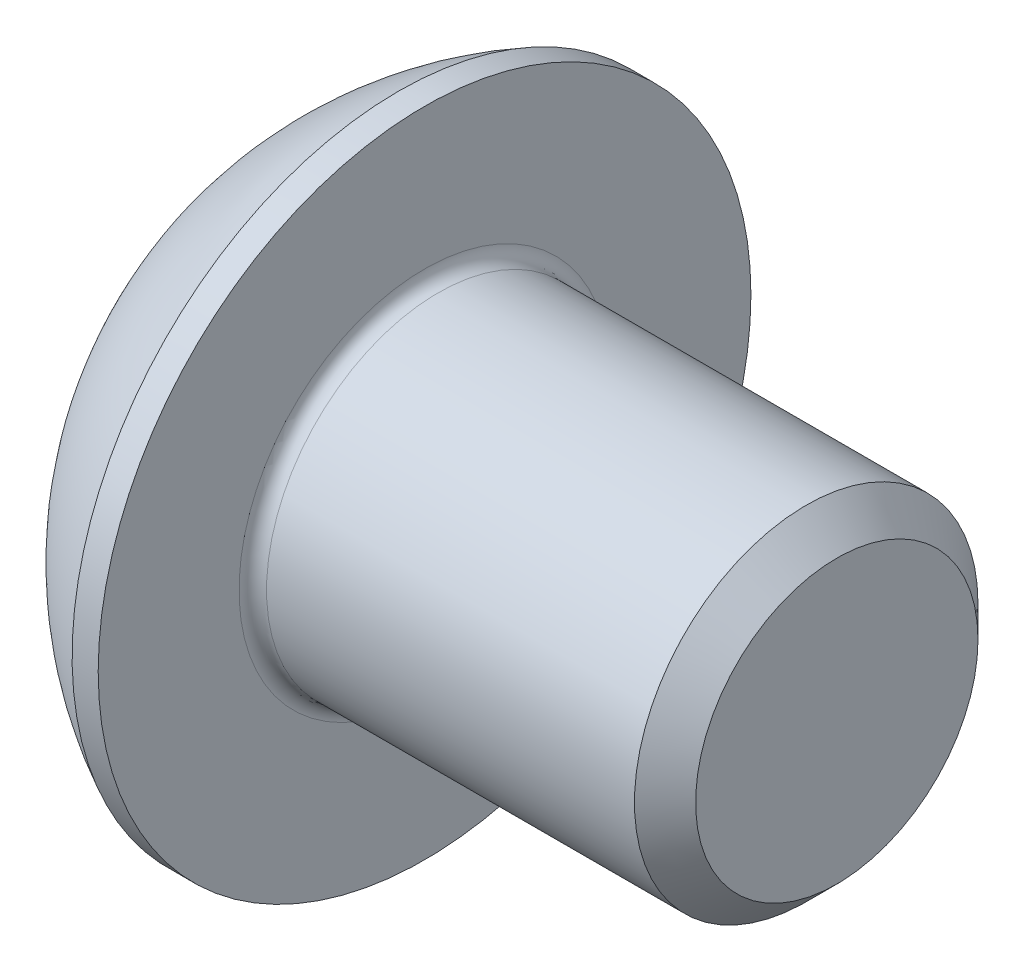
from build123d import *

# Parameters (mm, degrees)
FILLET_1_R  = 0.2
HEX_2_DEPTH = 1.56


with BuildPart() as part:
    # Эскиз1 → Body (revolve)
    with BuildSketch(Plane.XY):
        with BuildLine():
            Line((0, 2.375), (0, 0))
            Line((0, 0), (8.75, 0))
            Line((8.75, 0), (8.75, 2.055))
            Line((8.75, 2.055), (8.305, 2.5))
            Line((8.305, 2.5), (2.75, 2.5))
            Line((2.75, 2.5), (2.75, 4.75))
            Line((2.75, 4.75), (2.370164642, 4.75))
            ThreePointArc((2.370164642, 4.75), (0.992749859, 3.754440885), (0, 2.375))
        make_face()
    revolve(axis=Axis((-3.643489966, 0, 0), (-1, 0, 0)))

    # Скругление1
    fillet_1_edges = [part.edges().sort_by_distance(p)[0] for p in [
        (2.75, -2.5, 0),
    ]]
    fillet(fillet_1_edges, radius=FILLET_1_R)

    # Эскиз2 → Вырез-Повернуть1 (revolve, cut)
    with BuildSketch(Plane.XY):
        Polygon((0, 0), (0, 1.5), (1.56, 1.5), (2.426025404, 0), align=None)
    revolve(axis=Axis((2.426025404, 0, 0), (-1, 0, 0)), mode=Mode.SUBTRACT)

    # Эскиз3 → Hex 2 (cut)
    with BuildSketch(Plane.ZY):
        Polygon((-1.5, -0.866025404), (0, -1.732050808), (1.5, -0.866025404), (1.5, 0.866025404), (0, 1.732050808), (-1.5, 0.866025404), align=None)
    extrude(amount=-HEX_2_DEPTH, mode=Mode.SUBTRACT)


solid = part.part
